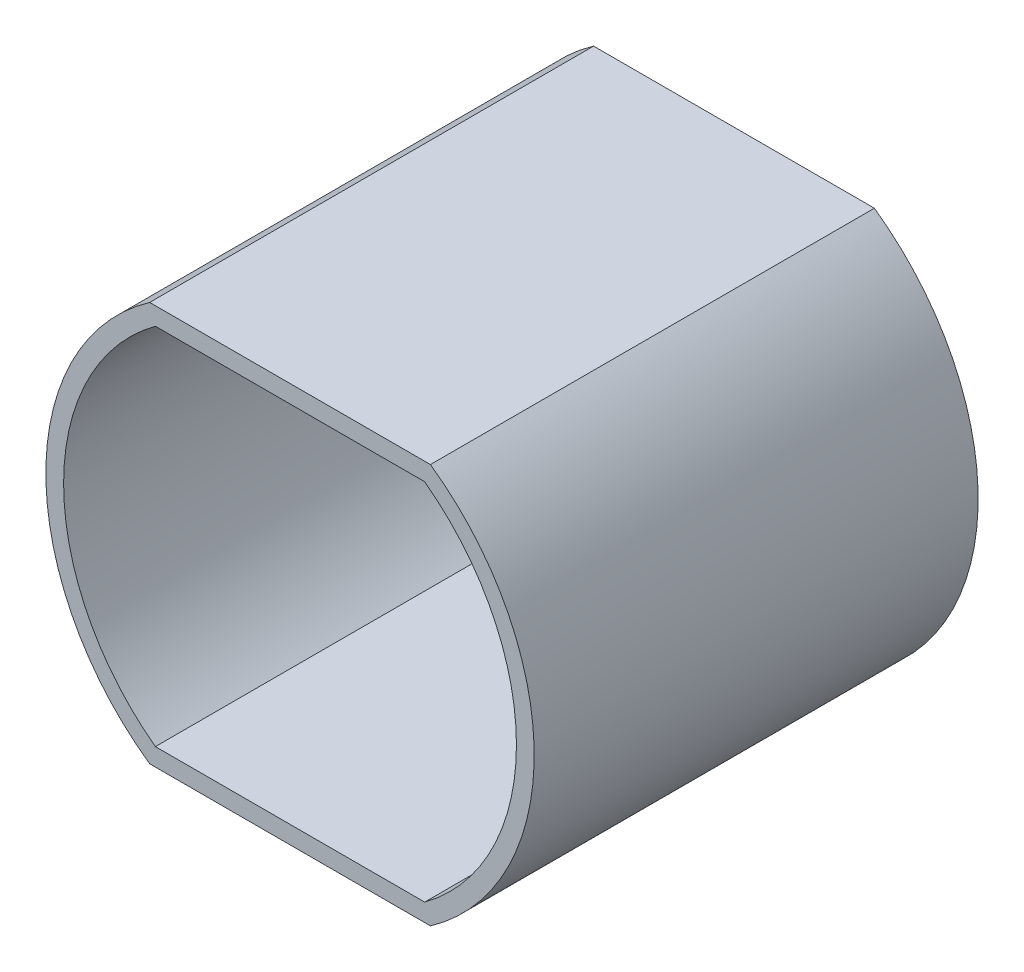
from build123d import *

# Parameters (mm, degrees)
SKETCH2_R           = 4.75
BOSS_EXTRUDE8_DEPTH = 50
SHELL4_T            = -2


with BuildPart() as part:
    # Sketch2 → Boss-Extrude8 (new body)
    with BuildSketch(Plane.XY):
        with BuildLine():
            Line((15.811388301, 22.5), (-15.811388301, 22.5))
            ThreePointArc((-15.811388301, 22.5), (-27.5, 0), (-15.811388301, -22.5))
            Line((-15.811388301, -22.5), (15.811388301, -22.5))
            ThreePointArc((15.811388301, -22.5), (27.5, 0), (15.811388301, 22.5))
        make_face()
        Circle(SKETCH2_R, mode=Mode.SUBTRACT)
    extrude(amount=BOSS_EXTRUDE8_DEPTH)

    # Shell4
    shell4_openings = [part.faces().sort_by_distance(p)[0] for p in [
        (-4.75, 0, 25),
        (0, -21.78936648, 50),
    ]]
    offset(amount=SHELL4_T, openings=shell4_openings, kind=Kind.INTERSECTION)


solid = part.part
